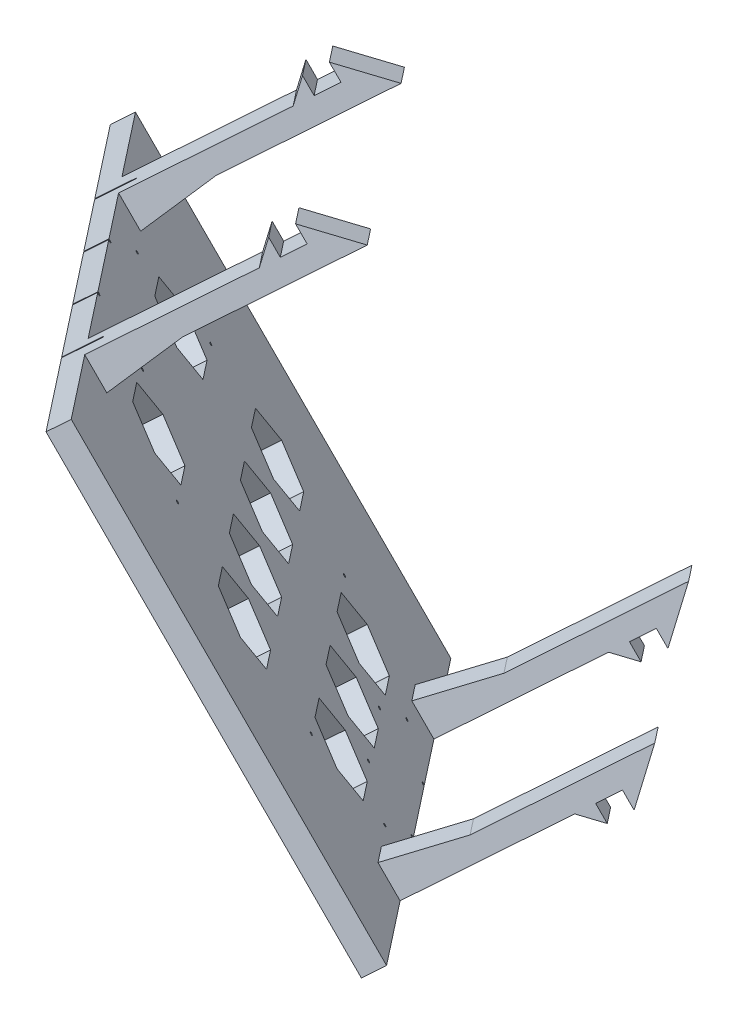
from build123d import *

# Parameters (mm, degrees)
EXTRUDE_1_DEPTH             = 3
EXTRUDE_2_DEPTH             = 5
CHAMFER_1_SIZE              = 10
CHAMFER_1_SIZE2             = 1.7632698070846538
CHAMFER_1_OF_MIRROR_1_SIZE2 = 1.7632698070846538
CHAMFER_1_OF_MIRROR_1_SIZE  = 10
MIRROR_START                = 71.461889227
MIRROR_2_DEPTH              = 5
MIRROR_START_2              = 121.461889227
MIRROR_2_2_DEPTH            = 5
CUT_EXTRUDE_1_DEPTH         = 5
EXTRUDE_3_DEPTH             = 5
MIRROR_4_COPY_1_DEPTH       = 5


# Read off the part's stored shape, not the designer's step: 镜向2
with BuildPart() as part:
    # 草图1 → 凸台-拉伸1 (new body)
    with BuildSketch(Plane(origin=(-254.08518670544765, -215.94079292529062, 298.6289441038084), x_dir=(0.823284870968576, -0.3326085977835135, 0.459971240312631), z_dir=(-0.5676284182757724, -0.4824135256318378, 0.6671395424146325))):
        Polygon((-177.691196278339, 290.9252800078966), (-105.02181846395744, 352.1148340843131), (-61.22297975662783, 300.0988583855979), (-133.89235757100943, 238.9093043091815), align=None)
    extrude(amount=EXTRUDE_1_DEPTH)

    # 草图2 → 凸台-拉伸2 (add)
    with BuildSketch(Plane(origin=(48.15296077122405, 20.454601814972193, 55.76129605536246), x_dir=(-0.7767863592562881, 0.2168814389007045, 0.5912405547099429), z_dir=(-0.6297642035503137, -0.2675136858592245, -0.7292691381133932))):
        Polygon((559.3396383260294, -61.3696390722944), (537.7828252594776, -41.231272445039686), (539.4894664990754, -39.40442388007759), (531.7157889290436, -39.66887999587859), (557.291668838512, -63.56185735024883), align=None)
    extrude_2 = extrude(amount=EXTRUDE_2_DEPTH)

    # 倒角1
    chamfer_1_edges = [part.edges().sort_by_distance(p)[0] for p in [
        (-384.6151309637531, 82.42559682113395, 403.3198996988836),
    ]]
    chamfer_1_side = [part.faces().sort_by_distance(p)[0] for p in [
        (-375.53307627134075, 90.14421323124334, 392.64566702024945),
    ]]
    chamfer(chamfer_1_edges, length=CHAMFER_1_SIZE, length2=CHAMFER_1_SIZE2, reference=chamfer_1_side[0])

    # 镜向1: 凸台-拉伸2 across plane
    add(extrude_2.mirror(Plane(origin=(62.32265535110613, 26.47365974680476, 72.16985166291381), x_dir=(-0.6712211429872029, -0.2851239257088115, 0.6842269537188292), z_dir=(0.6297642035503136, 0.26751368585922486, 0.729269138113393))))

    # 倒角1 of 镜向1
    chamfer_1_of_mirror_1_edges = [part.edges().sort_by_distance(p)[0] for p in [
        (-353.1269207862374, 95.80128111409518, 439.7833566045532),
    ]]
    chamfer(chamfer_1_of_mirror_1_edges, length=CHAMFER_1_OF_MIRROR_1_SIZE, length2=CHAMFER_1_OF_MIRROR_1_SIZE2)

    # 镜向2 outline → 镜向2 (add)
    with BuildSketch(Plane(origin=(0, 0, 0), x_dir=(0.7767863592562853, -0.21688143890070205, -0.5912405547099476), z_dir=(0.6297642035503173, 0.267513685859219, 0.7292691381133922)).offset(MIRROR_START)):
        Polygon((-510.726778331, -109.011950552), (-491.362183542, -90.921553412), (-489.655542303, -92.748401977), (-489.391086187, -84.974724407), (-505.467353559, -99.993167315), (-513.978455406, -105.531241507), align=None)
    extrude(amount=MIRROR_2_DEPTH)

    # Mirror 2 2 outline → Mirror 2 2 (add)
    with BuildSketch(Plane(origin=(0, 0, 0), x_dir=(0.7767863592562853, -0.21688143890070205, -0.5912405547099476), z_dir=(0.6297642035503173, 0.267513685859219, 0.7292691381133922)).offset(MIRROR_START_2)):
        Polygon((-510.726778331, -109.011950552), (-491.362183542, -90.921553412), (-489.655542303, -92.748401977), (-489.391086187, -84.974724407), (-505.467353559, -99.993167315), (-513.978455406, -105.531241507), align=None)
    extrude(amount=MIRROR_2_2_DEPTH)

    # 草图3 → 切除-拉伸1 (cut)
    with BuildSketch(Plane(origin=(-255.78807196027503, -217.38803350218623, 300.6303627310524), x_dir=(0.8232848709685762, -0.3326085977835133, 0.45997124031263076), z_dir=(-0.5676284182757722, -0.48241352563183804, 0.6671395424146325))):
        Polygon((-141.16212912953188, 308.80735608731425), (-141.20563567070687, 309.0516430711963), (-141.43894767515, 309.1361087932488), (-141.62875313841815, 308.97628753141964), (-141.58524659724313, 308.7320005475376), (-141.35193459279995, 308.647534825485), align=None)
        Polygon((-105.74508817947027, 274.5698917914525), (-101.15544326487968, 278.43449520680355), (-102.20746554083055, 284.3415460048649), (-107.84913273137192, 286.383993387575), (-112.43877764596279, 282.51938997222373), (-111.38675537001195, 276.61233917416274), align=None)
        Polygon((-133.5950950524365, 283.60749023905043), (-139.23676224297986, 285.6499376217612), (-143.82640715757208, 281.78533420640883), (-142.77438488162096, 275.87828340834574), (-137.13271769108007, 273.8358360256359), (-132.5430727764854, 277.70043944098734), align=None)
        Polygon((-138.96479448533228, 297.98834383927124), (-140.01681676128345, 303.89539463733456), (-145.65848395182675, 305.93784202004525), (-150.24812886641897, 302.0732386046929), (-149.19610659046785, 296.16618780662986), (-143.55443939992435, 294.12374042391906), align=None)
        Polygon((-120.06011887510512, 288.2114195230372), (-121.11214115105628, 294.1184703211003), (-126.75380834159961, 296.16091770381104), (-131.34345325619182, 292.29631428845863), (-130.29143098024068, 286.38926349039554), (-124.64976378969737, 284.34681610768484), align=None)
        Polygon((-147.23316856317507, 290.6759767190764), (-147.2766751043501, 290.9202637029585), (-147.50998710879313, 291.0047294250111), (-147.69979257206126, 290.84490816318174), (-147.65628603088626, 290.6006211792999), (-147.4229740264431, 290.5161554572472), align=None)
        Polygon((-150.44050468396148, 307.1519820927005), (-150.4840112251365, 307.39626907658254), (-150.71732322957953, 307.4807347986351), (-150.90712869284766, 307.32091353680585), (-150.86362215167267, 307.07662655292387), (-150.63031014722955, 306.9921608308713), align=None)
        Polygon((-147.22948414206095, 316.0130126800856), (-147.27299068323595, 316.2572996639675), (-147.50630268767915, 316.3417653860202), (-147.69610815094728, 316.18194412419086), (-147.6526016097723, 315.93765714030894), (-147.41928960532908, 315.8531914182563), align=None)
        Polygon((-159.71888023839094, 305.4966080980869), (-159.76238677956593, 305.7408950819688), (-159.99569878400905, 305.82536080402133), (-160.18550424727715, 305.665539542192), (-160.1419977061022, 305.4212525583101), (-159.90868570165918, 305.33678683625755), align=None)
        Polygon((-122.67380941711224, 336.9704663043067), (-122.44049741266916, 336.886000582254), (-122.25069194940096, 337.0458218440834), (-122.29419849057591, 337.29010882796524), (-122.527510495019, 337.3745745500178), (-122.71731595828716, 337.21475328818855), align=None)
        Polygon((-135.16320551344214, 326.4540617223078), (-134.92989350899904, 326.36959600025517), (-134.7400880457309, 326.52941726208445), (-134.7835945869059, 326.77370424596654), (-135.01690659134903, 326.85816996801907), (-135.2067120546172, 326.6983487061898), align=None)
        Polygon((-125.88482995901259, 328.1094357169217), (-125.65151795456941, 328.0249699948691), (-125.46171249130134, 328.1847912566983), (-125.50521903247636, 328.4290782405802), (-125.73853103691948, 328.51354396263287), (-125.92833650018758, 328.3537227008036), align=None)
        Polygon((-110.19552288224374, 322.1435827591093), (-109.96221087780047, 322.0591170370566), (-109.77240541453244, 322.21893829888575), (-109.81591195570743, 322.4632252827678), (-110.04922396015057, 322.54769100482036), (-110.23902942341873, 322.3878697429911), align=None)
        Polygon((-108.62274505472611, 304.6348749030992), (-114.26441224526943, 306.67732228580996), (-118.8540571598617, 302.8127188704576), (-117.80203488391052, 296.9056680723945), (-112.16036769336723, 294.86322068968377), (-107.57072277877496, 298.7278241050362), align=None)
        Polygon((-124.21731439780777, 317.19899697062766), (-118.57564720726421, 315.15654958791686), (-113.98600229267213, 319.02115300326903), (-115.03802456862333, 324.9282038013323), (-120.67969175916666, 326.97065118404305), (-125.26933667375883, 323.1060477686907), align=None)
        Polygon((-106.3711032584814, 313.3236989525075), (-105.31908098253024, 307.4166481544444), (-99.67741379198692, 305.3742007717337), (-95.08776887739472, 309.238804187086), (-96.13979115334587, 315.1458549851491), (-101.78145834388917, 317.1883023678598), align=None)
        Polygon((-129.095850500913, 319.2484051295366), (-128.86253849646977, 319.163939407484), (-128.6727330332017, 319.32376066931323), (-128.7162395743767, 319.5680476531952), (-128.9495515788199, 319.65251337524785), (-129.13935704208794, 319.4926921134185), align=None)
        Polygon((-97.75204690543491, 282.2167823061805), (-97.70854036425995, 281.9724953222985), (-97.47522835981678, 281.888029600246), (-97.28542289654868, 282.0478508620751), (-97.32892943772373, 282.2921378459572), (-97.56224144216685, 282.3766035680098), align=None)
        Polygon((-99.94938154963454, 293.03579455422357), (-98.89735927368336, 287.12874375616025), (-93.25569208314006, 285.08629637344956), (-88.66604716854779, 288.9508997888019), (-89.718069444499, 294.85795058686494), (-95.35973663504248, 296.9003979695758), align=None)
        Polygon((-91.68100747179177, 300.34816167441835), (-91.63750093061672, 300.1038746905363), (-91.40418892617366, 300.01940896848373), (-91.21438346290554, 300.17923023031307), (-91.25789000408054, 300.423517214195), (-91.49120200852376, 300.50798293624763), align=None)
        Polygon((-88.47367135100531, 283.8721563007943), (-88.43016480983037, 283.62786931691227), (-88.19685280538721, 283.5434035948597), (-88.00704734211912, 283.7032248566889), (-88.05055388329417, 283.94751184057094), (-88.28386588773726, 284.0319775626235), align=None)
        Polygon((-91.68469189290587, 275.0111257134092), (-91.64118535173087, 274.76683872952736), (-91.40787334728769, 274.68237300747455), (-91.21806788401956, 274.84219426930395), (-91.26157442519451, 275.08648125318587), (-91.49488642963777, 275.1709469752385), align=None)
        Polygon((-79.19529579657592, 285.5275302954079), (-79.15178925540083, 285.28324331152606), (-78.91847725095778, 285.1987775894734), (-78.72867178768959, 285.35859885130276), (-78.7721783288646, 285.60288583518474), (-79.00549033330765, 285.6873515572372), align=None)
        Polygon((-116.24036661785455, 254.05367208918815), (-116.47367862229763, 254.13813781124082), (-116.66348408556581, 253.97831654941137), (-116.61997754439086, 253.7340295655296), (-116.38666553994778, 253.64956384347693), (-116.1968600766796, 253.80938510530626), align=None)
        Polygon((-103.75097052152466, 264.57007667118705), (-103.98428252596779, 264.65454239323964), (-104.1740879892359, 264.49472113141036), (-104.13058144806087, 264.2504341475284), (-103.89726944361777, 264.16596842547574), (-103.70746398034956, 264.325789687305), align=None)
        Polygon((-113.02934607595417, 262.91470267657314), (-113.26265808039739, 262.9991683986257), (-113.45246354366544, 262.8393471367965), (-113.40895700249045, 262.59506015291464), (-113.17564499804728, 262.51059443086194), (-112.98583953477919, 262.6704156926912), align=None)
        Polygon((-128.71865315272305, 268.8805556343856), (-128.9519651571663, 268.9650213564382), (-129.14177062043436, 268.80520009460906), (-129.0982640792593, 268.56091311072703), (-128.86495207481622, 268.47644738867444), (-128.67514661154806, 268.6362686505037), align=None)
        Polygon((-114.69686163715903, 273.8251414228672), (-120.3385288277026, 275.867588805578), (-124.92817374229465, 272.0029853902258), (-123.87615146634346, 266.0959345921625), (-118.23448427580013, 264.05348720945176), (-113.64483936120794, 267.91809062480417), align=None)
        Polygon((-109.8183255340538, 271.7757332639582), (-110.051637538497, 271.8601989860108), (-110.24144300176508, 271.7003777241816), (-110.19793646059009, 271.45609074029966), (-109.96462445614686, 271.37162501824696), (-109.77481899287888, 271.5314462800763), align=None)
    extrude(amount=-CUT_EXTRUDE_1_DEPTH, mode=Mode.SUBTRACT)

    # 草图4 → 凸台-拉伸3 (add)
    with BuildSketch(Plane(origin=(45.004139753474234, 19.117033385677637, 52.11495036479807), x_dir=(-0.7767863592562869, 0.216881438900701, 0.5912405547099456), z_dir=(-0.6297642035503151, -0.2675136858592191, -0.729269138113394))):
        Polygon((540.1211914226311, -43.41577323172574), (541.827832662229, -41.5889246667637), (541.9480399875933, -45.122414471323566), align=None)
    extrude_3 = extrude(amount=-EXTRUDE_3_DEPTH)

    # 镜向3: 凸台-拉伸3 across plane
    add(extrude_3.mirror(Plane(origin=(62.32265535110613, 26.47365974680476, 72.16985166291381), x_dir=(-0.6712211429872029, -0.2851239257088115, 0.6842269537188292), z_dir=(0.6297642035503136, 0.26751368585922486, 0.729269138113393))))

    # 镜向4: 凸台-拉伸3 across plane
    add(extrude_3.mirror(Plane(origin=(-160.66986864586198, 252.72364295764066, 46.0421220042147), x_dir=(0.08152701690098424, -0.12823689273126515, 0.9883868902701293), z_dir=(-0.5302782540255494, 0.8340944899503124, 0.1519583993800388))))

    # 镜向4 copy 1 sketch → 镜向4 copy 1 (add)
    with BuildSketch(Plane(origin=(-241.69856634298634, 539.2775720232137, 184.30899696945895), x_dir=(-0.05279056983072454, -0.9219186045157413, 0.3837697778417371), z_dir=(0.6297642035503169, 0.2675136858592234, 0.7292691381133908))):
        Polygon((540.1211914226311, -43.41577323172574), (541.827832662229, -41.5889246667637), (541.9480399875933, -45.122414471323566), align=None)
    extrude(amount=-MIRROR_4_COPY_1_DEPTH)


solid = part.part
